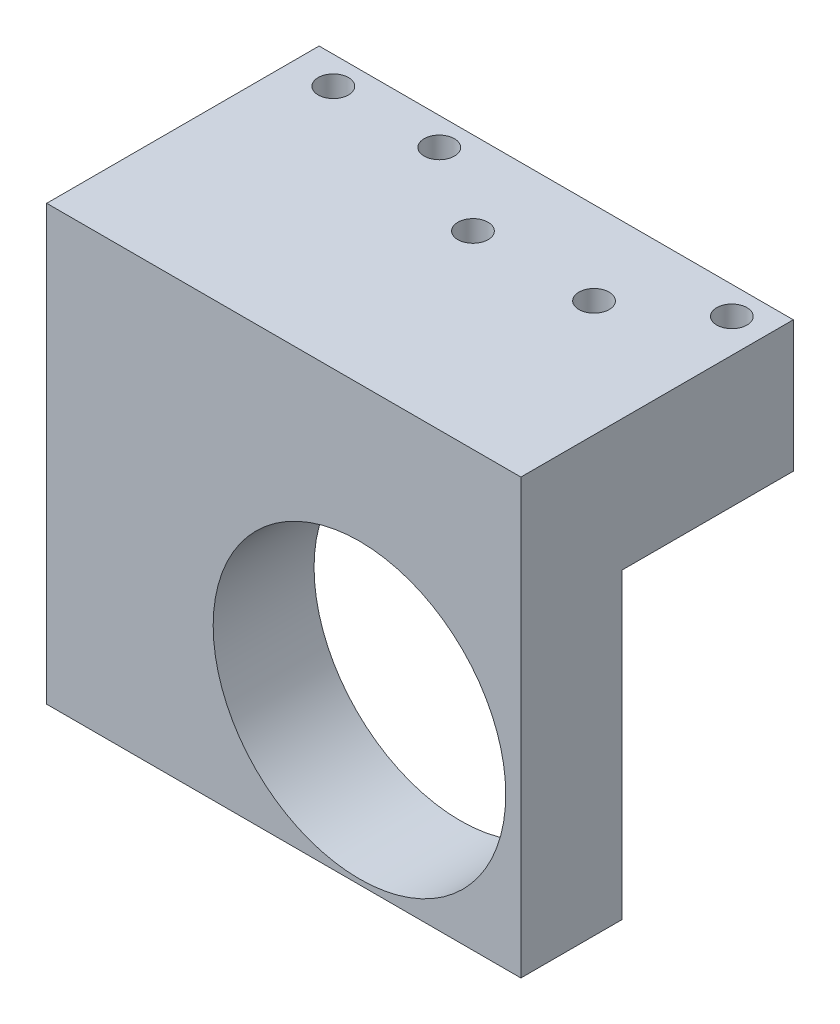
from build123d import *

# Parameters (mm, degrees)
SKETCH_1_R      = 1.5
EXTRUDE_1_DEPTH = 13
SKETCH_2_W      = 47
SKETCH_2_H      = 30
SKETCH_2_R      = 14.5
EXTRUDE_2_DEPTH = 10


with BuildPart() as part:
    # 草图1 → 凸台-拉伸1 (new body)
    with BuildSketch(Plane(origin=(0, 0, 0), x_dir=(1, 0, 0), z_dir=(0, 1, 0))):
        Polygon((-23.5, -5.5), (-23.5, -21.5), (23.5, -21.5), (23.5, -5.5), (23.5, 5.5), (-23.5, 5.5), align=None)
        with Locations((20.159242617, 2.75)):
            Circle(SKETCH_1_R, mode=Mode.SUBTRACT)
        with Locations((-8.840757383, 2.75)):
            Circle(SKETCH_1_R, mode=Mode.SUBTRACT)
        with Locations((-19.340757383, 2.75)):
            Circle(SKETCH_1_R, mode=Mode.SUBTRACT)
        with Locations((0, -2.75)):
            Circle(SKETCH_1_R, mode=Mode.SUBTRACT)
        with Locations((12, -2.75)):
            Circle(SKETCH_1_R, mode=Mode.SUBTRACT)
    extrude(amount=EXTRUDE_1_DEPTH)

    # 草图2 → 凸台-拉伸2 (add)
    with BuildSketch(Plane.XY.offset(21.5)):
        with Locations((0, -15)):
            Rectangle(SKETCH_2_W, SKETCH_2_H)
        with Locations((7.5, -15)):
            Circle(SKETCH_2_R, mode=Mode.SUBTRACT)
    extrude(amount=-EXTRUDE_2_DEPTH)


solid = part.part
